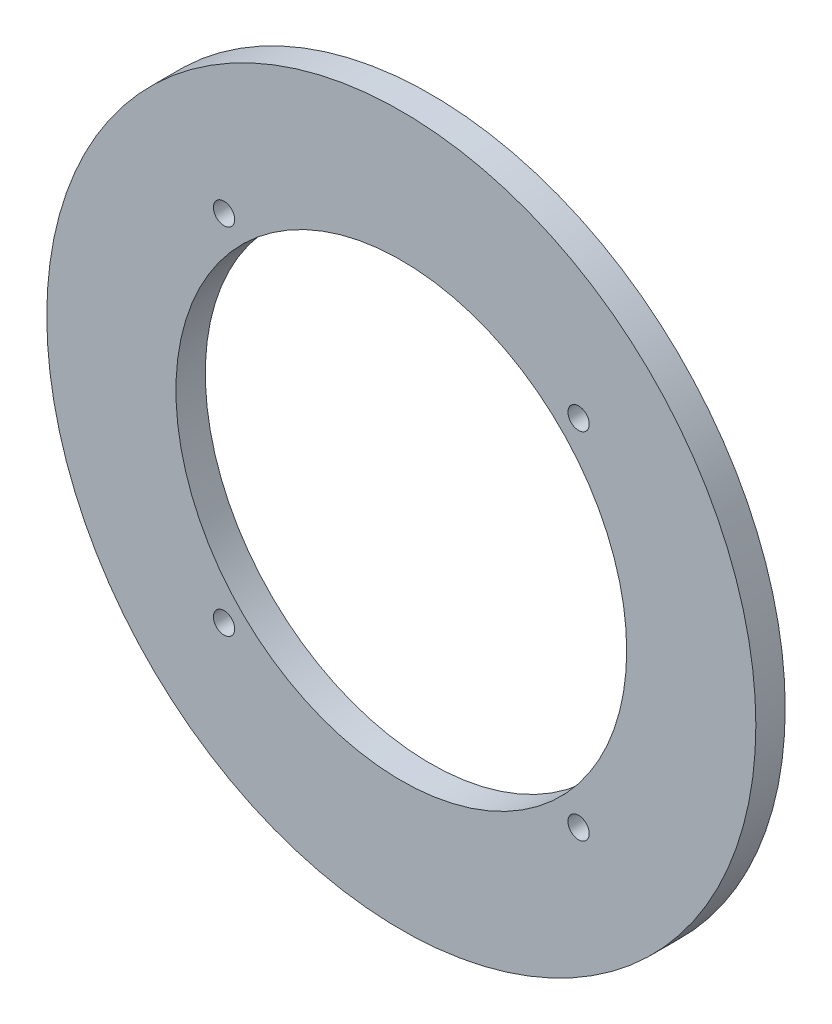
from build123d import *

# Parameters (mm, degrees)
SKETCH_1_R          = 70
SKETCH_1_R_2        = 44.5
EXTRUDE_1_DEPTH     = 5.8
SKETCH_2_R          = 2.1
CUT_EXTRUDE_1_DEPTH = 100.164711465


with BuildPart() as part:
    # ｽｹｯﾁ1 → ﾎﾞｽ - 押し出し1 (new body)
    with BuildSketch(Plane.XY):
        Circle(SKETCH_1_R)
        Circle(SKETCH_1_R_2, mode=Mode.SUBTRACT)
    extrude(amount=EXTRUDE_1_DEPTH)

    # ｽｹｯﾁ2 → ｶｯﾄ - 押し出し1 (cut, through all)
    with BuildSketch(Plane.XY.offset(5.8)):
        with Locations((35, 35)):
            Circle(SKETCH_2_R)
        with Locations((35, -35)):
            Circle(SKETCH_2_R)
        with Locations((-35, -35)):
            Circle(SKETCH_2_R)
        with Locations((-35, 35)):
            Circle(SKETCH_2_R)
    extrude(amount=-CUT_EXTRUDE_1_DEPTH, mode=Mode.SUBTRACT)


solid = part.part
